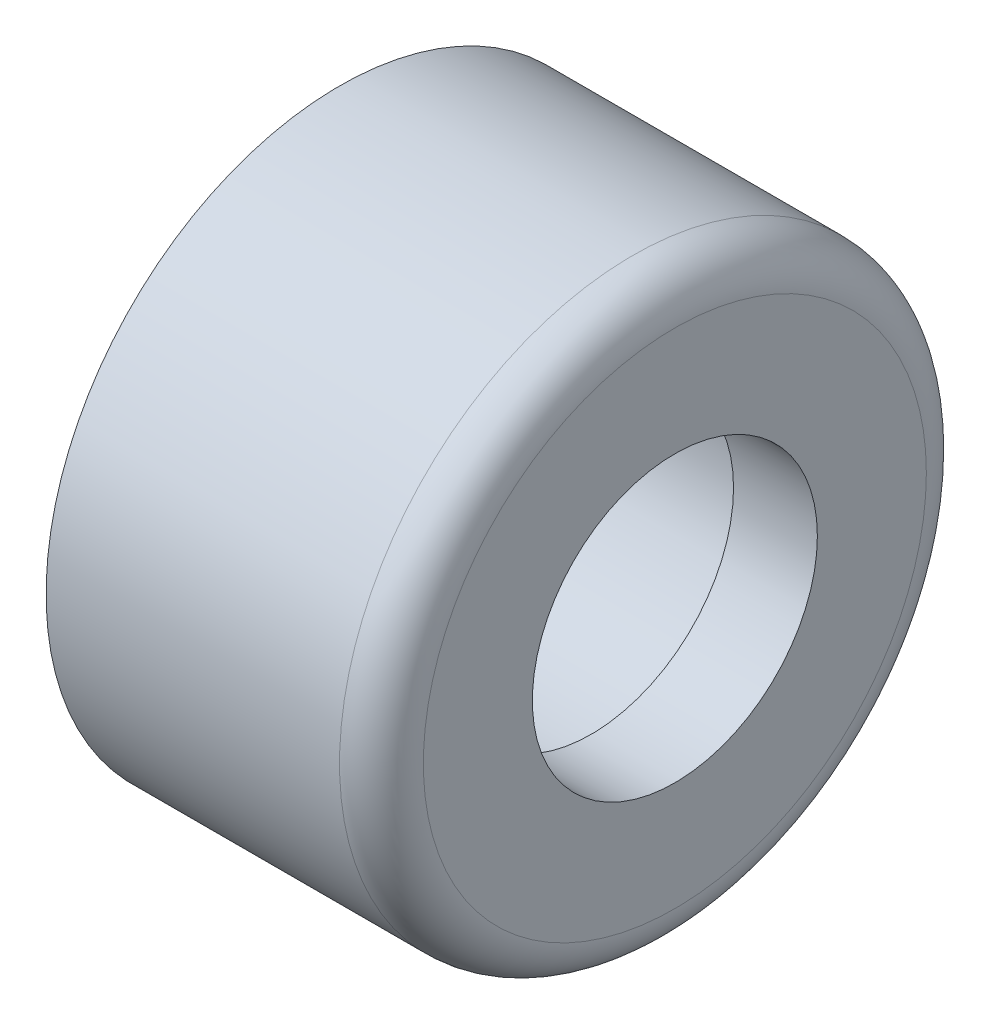
from build123d import *

# Parameters (mm, degrees)
CIRPATTERN1_COUNT = 4
FILLET1_R         = 2


with BuildPart() as part:
    # Sketch2 → Revolve1 (revolve)
    with BuildSketch(Plane(origin=(0, 0, 0), x_dir=(1, 0, 0), z_dir=(0, 1, 0))):
        Polygon((-8, 14), (8, 14), (8, 6.8), (4, 6.8), (4, 8), (-8, 8), align=None)
    revolve(axis=Axis((88.99, 0, 0), (-1, 0, 0)))

    # Sketch4 → Tap Drill for M3x0.5 Tap1 (revolve, cut)
    with BuildSketch(Plane(origin=(-8, 0, 10), x_dir=(0, 0, 1), z_dir=(0, 1, 0))):
        Polygon((0, 0), (0, 8.751075774), (1.25, 8), (1.25, 0), align=None)
    tap_drill_for_m3x0_5_tap1 = revolve(axis=Axis((-14.35, 0, 10), (1, 0, 0)), mode=Mode.SUBTRACT)

    # CirPattern1: Tap Drill for M3x0.5 Tap1 ×4 about axis
    cirpattern1_axis = Axis((88.99, 0, 0), (-1, 0, 0))
    for i in range(1, CIRPATTERN1_COUNT):
        add(tap_drill_for_m3x0_5_tap1.rotate(cirpattern1_axis, i * 360 / CIRPATTERN1_COUNT), mode=Mode.SUBTRACT)

    # Fillet1
    fillet1_edges = [part.edges().sort_by_distance(p)[0] for p in [
        (8, 0, 14),
    ]]
    fillet(fillet1_edges, radius=FILLET1_R)


solid = part.part
